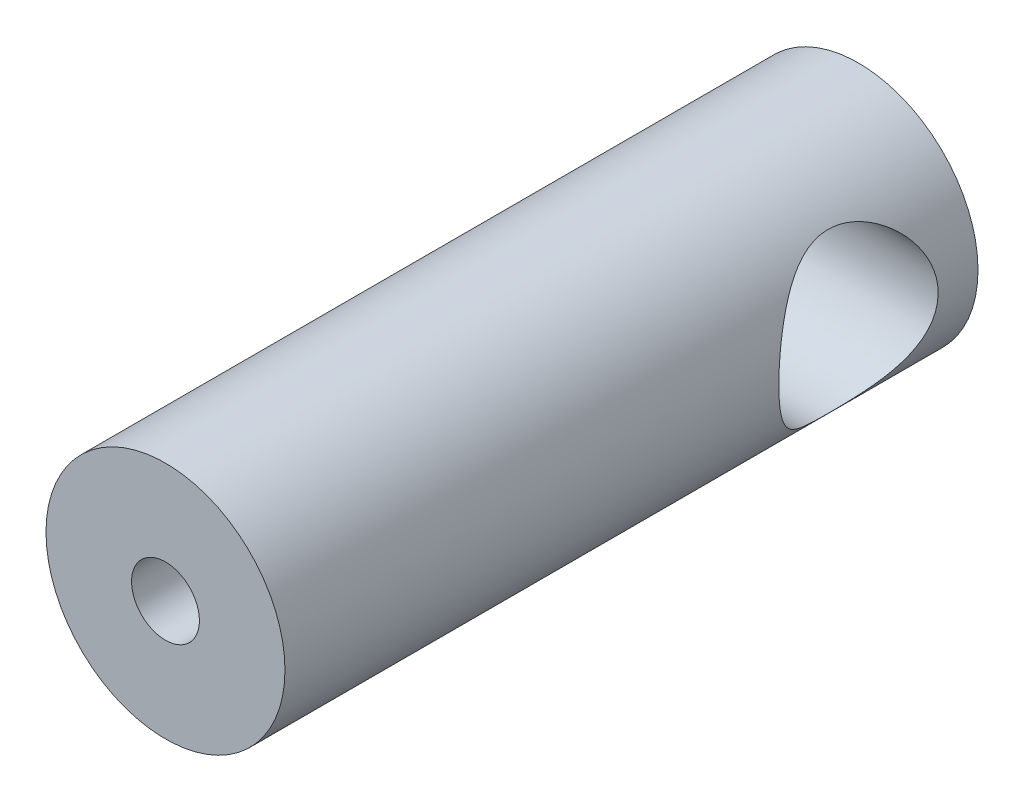
from build123d import *

# Parameters (mm, degrees)
SKETCH1_R                 = 4.7625
BOSS_EXTRUDE1_DEPTH       = 27.6225
CUT_EXTRUDE2_DEPTH        = 29.431766015
CUT_EXTRUDE2_DEPTH_BACK   = 29.431766015
SKETCH3_R                 = 3.175
F_6_32_TAPPED_HOLE1_D     = 2.7051
F_6_32_TAPPED_HOLE1_DEPTH = 12.7
F_6_32_TAPPED_HOLE1_TIP   = 0.81269403


with BuildPart() as part:
    # Sketch1 → Boss-Extrude1 (new body)
    with BuildSketch(Plane.XY):
        Circle(SKETCH1_R)
    extrude(amount=BOSS_EXTRUDE1_DEPTH)

    # Sketch3 → Cut-Extrude2 (cut, two sides: drawn at the far end of the back side and taken through both)
    with BuildSketch(Plane(origin=(0, 0, 0), x_dir=(0, 0, -1), z_dir=(1, 0, 0)).offset(-CUT_EXTRUDE2_DEPTH_BACK)):
        with Locations((-4.7625, 0)):
            Circle(SKETCH3_R)
    extrude(amount=CUT_EXTRUDE2_DEPTH + CUT_EXTRUDE2_DEPTH_BACK, mode=Mode.SUBTRACT)

    # #6-32 Tapped Hole1
    with Locations(Plane.XY.offset(27.6225)):
        with Locations((0, 0)):
            Hole(F_6_32_TAPPED_HOLE1_D / 2, depth=F_6_32_TAPPED_HOLE1_DEPTH)
            with Locations((0, 0, -(F_6_32_TAPPED_HOLE1_DEPTH + F_6_32_TAPPED_HOLE1_TIP / 2))):  # 118° drill point
                Cone(0, F_6_32_TAPPED_HOLE1_D / 2, F_6_32_TAPPED_HOLE1_TIP, mode=Mode.SUBTRACT)


solid = part.part
